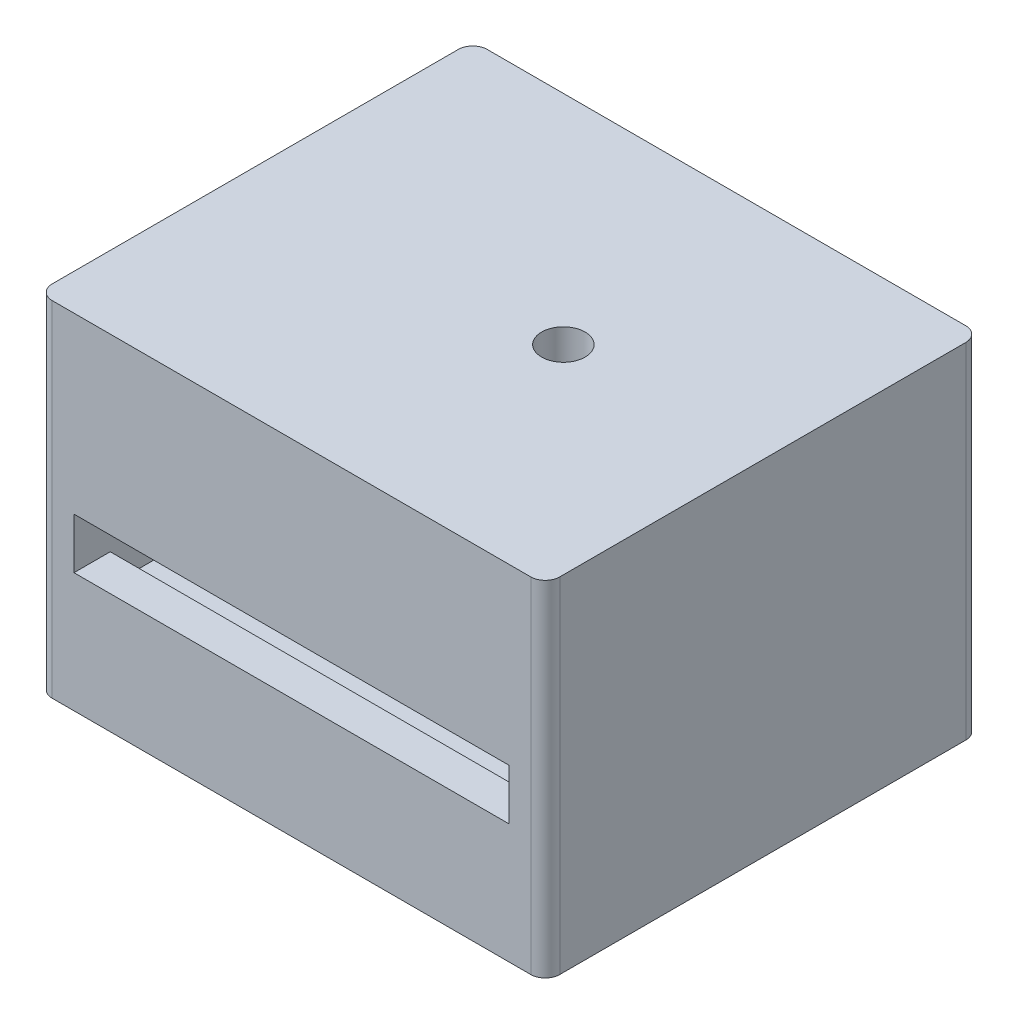
from build123d import *

# Parameters (mm, degrees)
BOX_EXTRUDE_DEPTH             = 90
BOX_EXTRUDE_DEPTH_BACK        = 5
SKETCH2_W                     = 140
SKETCH2_H                     = 120
BOX_INNER_CUT_START           = -20
SKETCH3_W                     = 120
SKETCH3_H                     = 100
BOX_INNER_CUT_DEPTH           = 50
SHAFT_CUT_START               = -70
SKETCH6_R                     = 6
SHAFT_CUT_DEPTH               = 20
BEARING_CUTS_INSIDE_BOX_START = -70
SKETCH9_R                     = 8
SKETCH9_R_2                   = 16
BEARING_CUTS_INSIDE_BOX_DEPTH = 10
SKETCH11_W                    = 120
SKETCH11_H                    = 14
SCISSOR_CUT_DEPTH             = 38
LEFT_BEARING_LID_CUT_START    = -10
SKETCH18_R                    = 8
LEFT_BEARING_LID_CUT_DEPTH    = 10
OUTER_EDGES_FILLET_R          = 4
RIGHT_BEARING_LID_CUT_REACH   = 134.382
SKETCH12_R                    = 6


with BuildPart() as part:
    # Sketch2 → BOX_EXTRUDE (new, two sides: drawn at the far end of the back side and taken through both)
    with BuildSketch(Plane(origin=(0, 0, 0), x_dir=(1, 0, 0), z_dir=(0, 1, 0)).offset(-BOX_EXTRUDE_DEPTH_BACK)):
        Rectangle(SKETCH2_W, SKETCH2_H)
    extrude(amount=BOX_EXTRUDE_DEPTH + BOX_EXTRUDE_DEPTH_BACK)

    # Sketch3 → BOX_INNER_CUT (cut)
    with BuildSketch(Plane(origin=(0, 90, 0), x_dir=(1, 0, 0), z_dir=(0, 1, 0)).offset(BOX_INNER_CUT_START)):
        Rectangle(SKETCH3_W, SKETCH3_H)
    extrude(amount=-BOX_INNER_CUT_DEPTH, mode=Mode.SUBTRACT)

    # Sketch6 → SHAFT_CUT (cut)
    with BuildSketch(Plane(origin=(0, 90, 0), x_dir=(1, 0, 0), z_dir=(0, 1, 0)).offset(SHAFT_CUT_START)):
        with Locations((15, 0)):
            Circle(SKETCH6_R)
        with Locations((-15, 0)):
            Circle(SKETCH6_R)
    extrude(amount=-SHAFT_CUT_DEPTH, mode=Mode.SUBTRACT)

    # Sketch9 → BEARING_CUTS_INSIDE_BOX (cut)
    with BuildSketch(Plane(origin=(0, 90, 0), x_dir=(1, 0, 0), z_dir=(0, 1, 0)).offset(BEARING_CUTS_INSIDE_BOX_START)):
        with Locations((15, 0)):
            Circle(SKETCH9_R)
        with Locations((-15, 0)):
            Circle(SKETCH9_R_2)
    extrude(amount=-BEARING_CUTS_INSIDE_BOX_DEPTH, mode=Mode.SUBTRACT)

    # Sketch11 → SCISSOR_CUT (cut)
    with BuildSketch(Plane.XY.offset(60)):
        with Locations((0, 35)):
            Rectangle(SKETCH11_W, SKETCH11_H)
    extrude(amount=-SCISSOR_CUT_DEPTH, mode=Mode.SUBTRACT)

    # Sketch18 → LEFT_BEARING_LID_CUT (cut)
    with BuildSketch(Plane(origin=(0, 90, 0), x_dir=(1, 0, 0), z_dir=(0, 1, 0)).offset(LEFT_BEARING_LID_CUT_START)):
        with Locations((-15, 0)):
            Circle(SKETCH18_R)
    extrude(amount=-LEFT_BEARING_LID_CUT_DEPTH, mode=Mode.SUBTRACT)

    # OUTER_EDGES_FILLET
    outer_edges_fillet_edges = [part.edges().sort_by_distance(p)[0] for p in [
        (-70, 42.5, -60),
        (70, 42.5, -60),
        (70, 42.5, 60),
        (-70, 42.5, 60),
    ]]
    fillet(outer_edges_fillet_edges, radius=OUTER_EDGES_FILLET_R)

    # Sketch12 → RIGHT_BEARING_LID_CUT (cut, up to next)
    with BuildSketch(Plane(origin=(0, 90, 0), x_dir=(1, 0, 0), z_dir=(0, 1, 0)), mode=Mode.PRIVATE) as right_bearing_lid_cut_sk1:
        with Locations((15, 0)):
            Circle(SKETCH12_R)
    right_bearing_lid_cut_tool1 = extrude(right_bearing_lid_cut_sk1.sketch, amount=-RIGHT_BEARING_LID_CUT_REACH, mode=Mode.PRIVATE) & part.part
    add(right_bearing_lid_cut_tool1.solids().sort_by_distance((15, 90, 0))[0], mode=Mode.SUBTRACT)


solid = part.part
